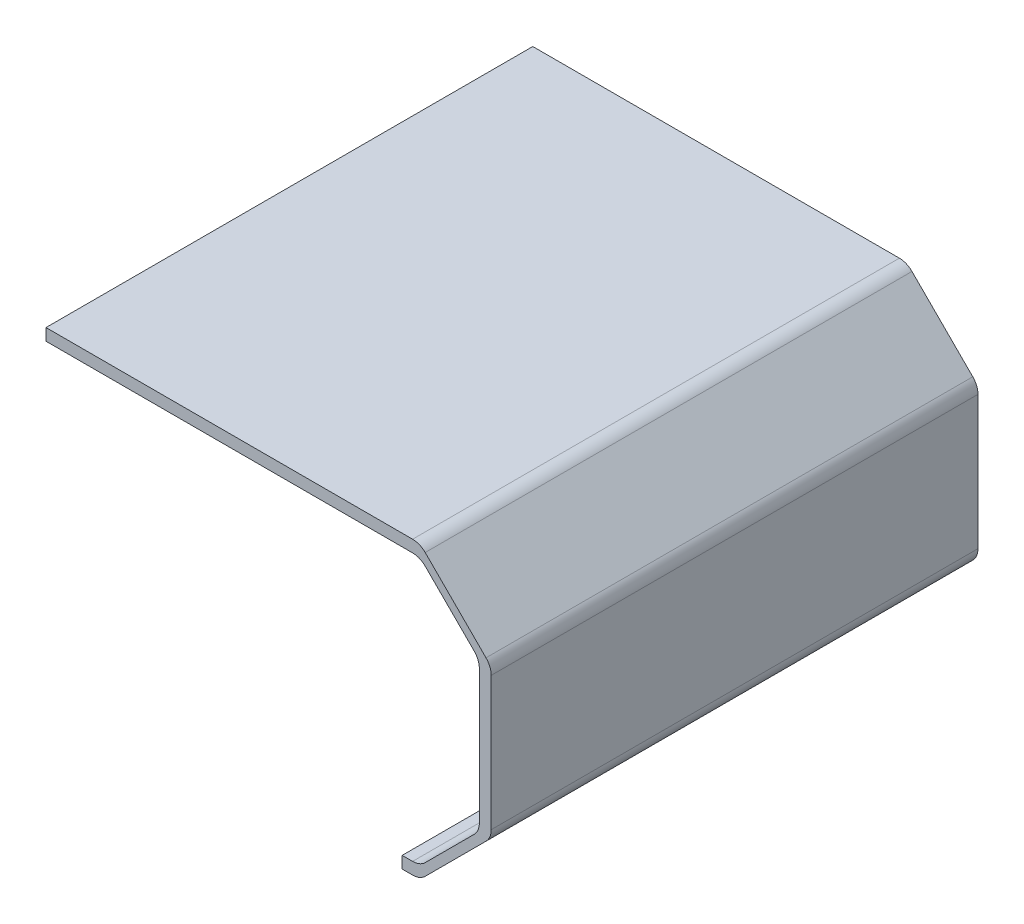
from build123d import *

# Parameters (mm, degrees)
EXTRUDE_1_DEPTH = 82
FILLET_1_R      = 3


with BuildPart() as part:
    # 草图1 → 凸台-拉伸1 (new body)
    with BuildSketch(Plane.XY):
        Polygon((0, 0), (0, 2), (3, 2), (13, 12), (13, 37), (3, 47), (-60, 47), (-60, 49), (3, 49), (15, 37), (15, 12), (3, 0), align=None)
    extrude(amount=EXTRUDE_1_DEPTH)

    # 圆角1
    fillet_1_edges = [part.edges().sort_by_distance(p)[0] for p in [
        (3, 0, 41),
        (15, 12, 41),
        (15, 37, 41),
        (3, 49, 41),
        (3, 2, 41),
        (13, 12, 41),
        (13, 37, 41),
        (3, 47, 41),
    ]]
    fillet(fillet_1_edges, radius=FILLET_1_R)


solid = part.part
